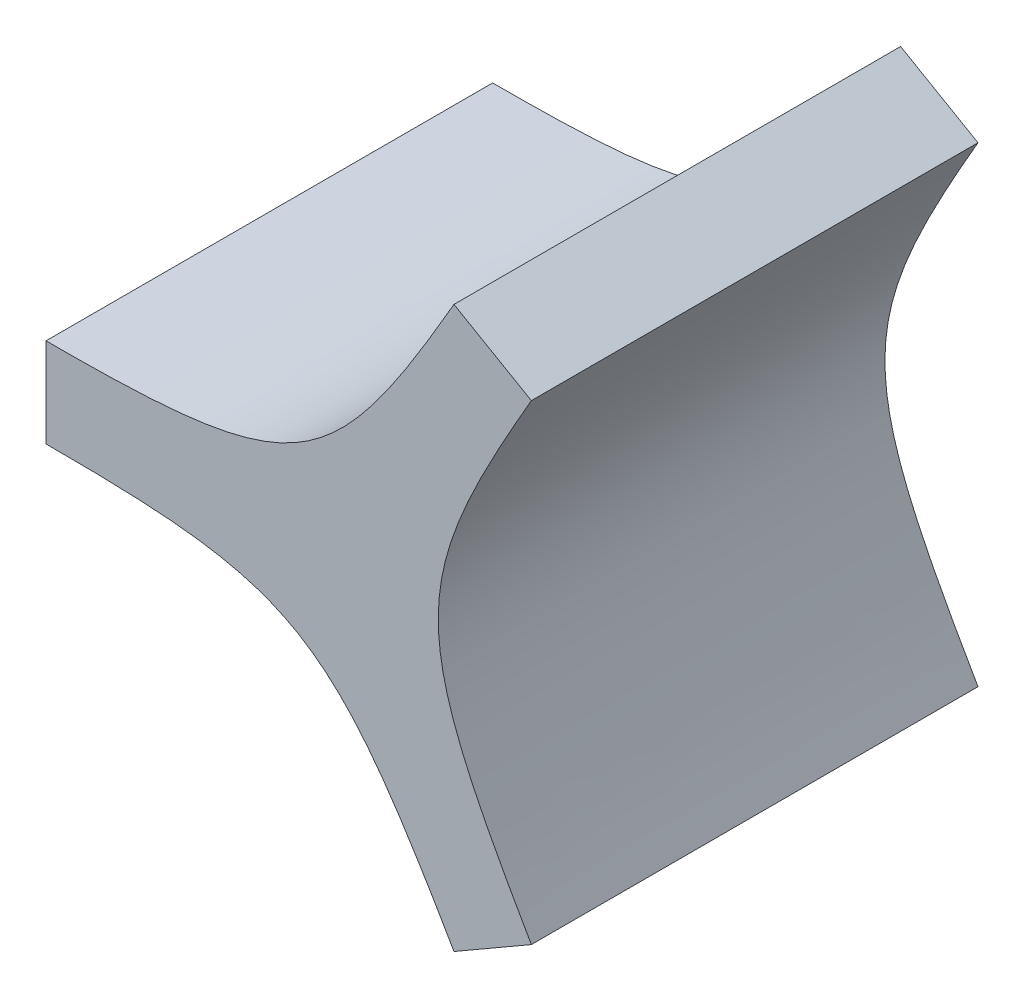
from build123d import *

# Parameters (mm, degrees)
BOSS_EXTRUDE1_START = 75
BOSS_EXTRUDE1_DEPTH = 7.5


with BuildPart() as part:
    # Sketch1 → Boss-Extrude1 (new, symmetric)
    with BuildSketch(Plane.XY.offset(BOSS_EXTRUDE1_START)):
        with BuildLine():
            Line((6.299037953, 7.910253905), (3.700961741, 9.410253905))
            add(Edge.make_bspline(
                [(-9.999999964, 1.5), (-1.666666631, 1.5), (-0.465704925, 2.19337554), (3.700961741, 9.410253905)],
                knots=[0, 0, 0, 0, 1, 1, 1, 1], degree=3))
            Line((-9.999999964, 1.5), (-9.999999964, -1.5))
            add(Edge.make_bspline(
                [(3.700961721, -9.410253941), (-0.465704946, -2.193375576), (-1.666666631, -1.5), (-9.999999964, -1.5)],
                knots=[0, 0, 0, 0, 1, 1, 1, 1], degree=3))
            Line((3.700961721, -9.410253941), (6.299037932, -7.910253941))
            add(Edge.make_bspline(
                [(6.299037953, 7.910253905), (2.132371286, 0.69337554), (2.132371265, -0.693375576), (6.299037932, -7.910253941)],
                knots=[0, 0, 0, 0, 1, 1, 1, 1], degree=3))
        make_face()
    extrude(amount=BOSS_EXTRUDE1_DEPTH, both=True)


solid = part.part
